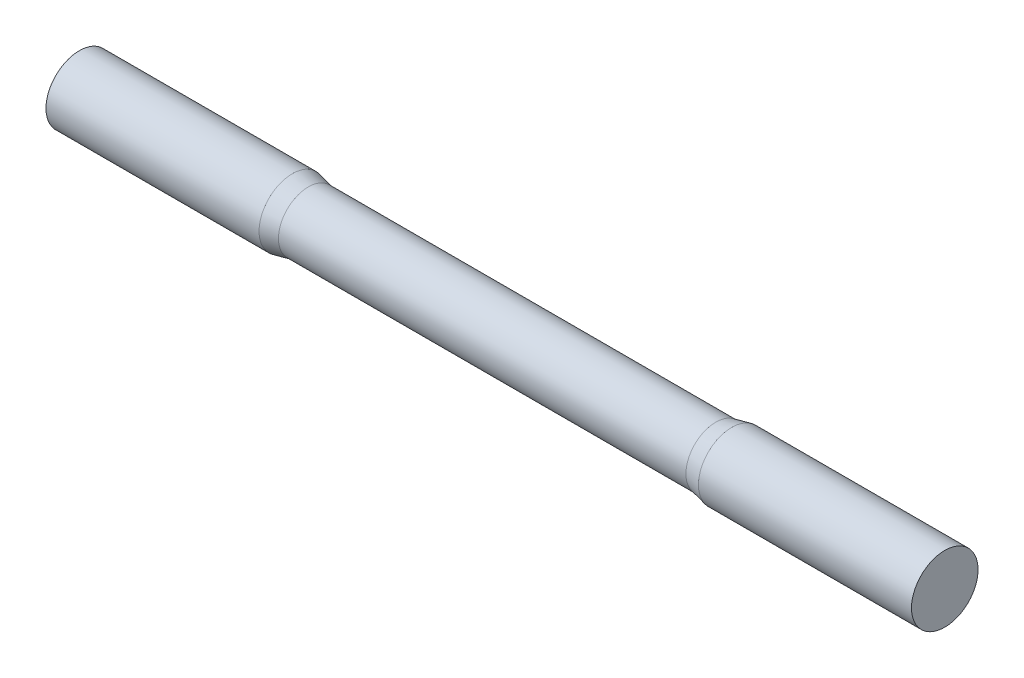
from build123d import *

# Parameters (mm, degrees)
SKETCH2_R      = 2.24
BASEBODY_DEPTH = 65


with BuildPart() as part:
    # Sketch2 → BaseBody (new body)
    with BuildSketch(Plane(origin=(0, 0, 0), x_dir=(0, 0, -1), z_dir=(1, 0, 0))):
        Circle(SKETCH2_R)
    extrude(amount=BASEBODY_DEPTH)

    # Sketch3 → BaseHead (revolve)
    with BuildSketch(Plane.XY):
        Polygon((65, 2.5), (65, 0), (47.8, 0), (47.8, 2.24), (49, 2.5), align=None)
    revolve(axis=Axis((-0.442011354, 0, 0), (1, 0, 0)))

    # Sketch6 → BaseEnd (revolve)
    with BuildSketch(Plane.XY):
        Polygon((0, 0), (0, 2.5), (16, 2.5), (17.2, 2.24), (17.2, 0), align=None)
    revolve(axis=Axis((-0.377128954, 0, 0), (1, 0, 0)))


solid = part.part
